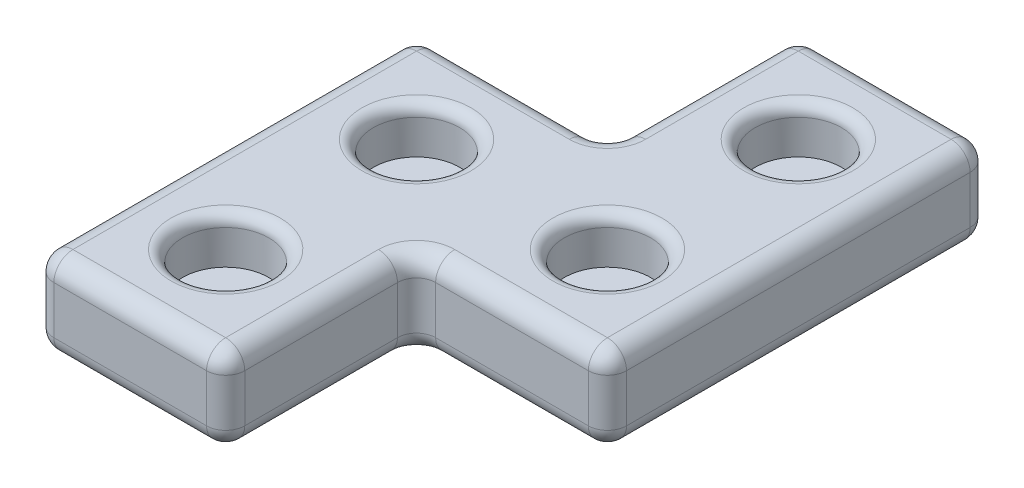
from build123d import *

# Parameters (mm, degrees)
BOSS_EXTRUDE1_DEPTH = 5.715
SKETCH2_R           = 2.8702
CUT_EXTRUDE1_DEPTH  = 3.048
FILLET1_R           = 1.27
FILLET2_R           = 1.27
FILLET3_R           = 0.762


with BuildPart() as part:
    # Sketch1 → Boss-Extrude1 (new body)
    with BuildSketch(Plane(origin=(0, 0, 0), x_dir=(1, 0, 0), z_dir=(0, 1, 0))):
        with BuildLine():
            Line((-7.665886605, 2.665075851), (-7.665886605, 12.825075851))
            ThreePointArc((-7.665886605, 12.825075851), (-7.293912217, 13.723101463), (-6.395886605, 14.095075851))
            Line((-6.395886605, 14.095075851), (3.764113395, 14.095075851))
            ThreePointArc((3.764113395, 14.095075851), (4.662139007, 13.723101463), (5.034113395, 12.825075851))
            Line((5.034113395, 12.825075851), (5.034113395, -10.034924149))
            ThreePointArc((5.034113395, -10.034924149), (4.662139007, -10.932949761), (3.764113395, -11.304924149))
            Line((3.764113395, -11.304924149), (-6.395886605, -11.304924149))
            ThreePointArc((-6.395886605, -11.304924149), (-7.293912217, -11.676898537), (-7.665886605, -12.574924149))
            Line((-7.665886605, -12.574924149), (-7.665886605, -22.734924149))
            ThreePointArc((-7.665886605, -22.734924149), (-8.037860993, -23.632949761), (-8.935886605, -24.004924149))
            Line((-8.935886605, -24.004924149), (-19.095886605, -24.004924149))
            ThreePointArc((-19.095886605, -24.004924149), (-19.993912217, -23.632949761), (-20.365886605, -22.734924149))
            Line((-20.365886605, -22.734924149), (-20.365886605, 0.125075851))
            ThreePointArc((-20.365886605, 0.125075851), (-19.993912217, 1.023101463), (-19.095886605, 1.395075851))
            Line((-19.095886605, 1.395075851), (-8.935886605, 1.395075851))
            ThreePointArc((-8.935886605, 1.395075851), (-8.037860993, 1.767050239), (-7.665886605, 2.665075851))
        make_face()
    extrude(amount=BOSS_EXTRUDE1_DEPTH)

    # Sketch2 → Cut-Extrude1 (cut)
    with BuildSketch(Plane(origin=(0, 5.715, 0), x_dir=(1, 0, 0), z_dir=(0, 1, 0))):
        with Locations((-1.315886605, 7.745075851)):
            Circle(SKETCH2_R)
        with Locations((-14.015886605, -4.954924149)):
            Circle(SKETCH2_R)
        with Locations((-14.015886605, -17.654924149)):
            Circle(SKETCH2_R)
        with Locations((-1.315886605, -4.954924149)):
            Circle(SKETCH2_R)
    extrude(amount=-CUT_EXTRUDE1_DEPTH, mode=Mode.SUBTRACT)

    # Fillet1
    fillet1_edges = [part.edges().sort_by_distance(p)[0] for p in [
        (-1.315886605, 5.715, 11.304924149),
        (-7.665886605, 5.715, 17.654924149),
        (-14.015886605, 5.715, 24.004924149),
        (-20.365886605, 5.715, 11.304924149),
        (-14.015886605, 5.715, -1.395075851),
        (-7.665886605, 5.715, -7.745075851),
        (-1.315886605, 5.715, -14.095075851),
        (5.034113395, 5.715, -1.395075851),
        (4.662139007, 5.715, 10.932949761),
        (-7.293912217, 5.715, 11.676898537),
        (-8.037860993, 5.715, 23.632949761),
        (-19.993912217, 5.715, 23.632949761),
        (-19.993912217, 5.715, -1.023101463),
        (-8.037860993, 5.715, -1.767050239),
        (-7.293912217, 5.715, -13.723101463),
        (4.662139007, 5.715, -13.723101463),
    ]]
    fillet(fillet1_edges, radius=FILLET1_R)

    # Fillet2
    fillet2_edges = [part.edges().sort_by_distance(p)[0] for p in [
        (-1.315886605, 0, -14.095075851),
        (-7.665886605, 0, -7.745075851),
        (-14.015886605, 0, -1.395075851),
        (-20.365886605, 0, 11.304924149),
        (-14.015886605, 0, 24.004924149),
        (-7.665886605, 0, 17.654924149),
        (-1.315886605, 0, 11.304924149),
        (5.034113395, 0, -1.395075851),
        (4.662139007, 0, 10.932949761),
        (-7.293912217, 0, 11.676898537),
        (-8.037860993, 0, 23.632949761),
        (-19.993912217, 0, 23.632949761),
        (-19.993912217, 0, -1.023101463),
        (-8.037860993, 0, -1.767050239),
        (-7.293912217, 0, -13.723101463),
        (4.662139007, 0, -13.723101463),
    ]]
    fillet(fillet2_edges, radius=FILLET2_R)

    # Fillet3
    fillet3_edges = [part.edges().sort_by_distance(p)[0] for p in [
        (-16.886086605, 5.715, 17.654924149),
        (-16.886086605, 5.715, 4.954924149),
        (-4.186086605, 5.715, 4.954924149),
        (-4.186086605, 5.715, -7.745075851),
    ]]
    fillet(fillet3_edges, radius=FILLET3_R)


solid = part.part
